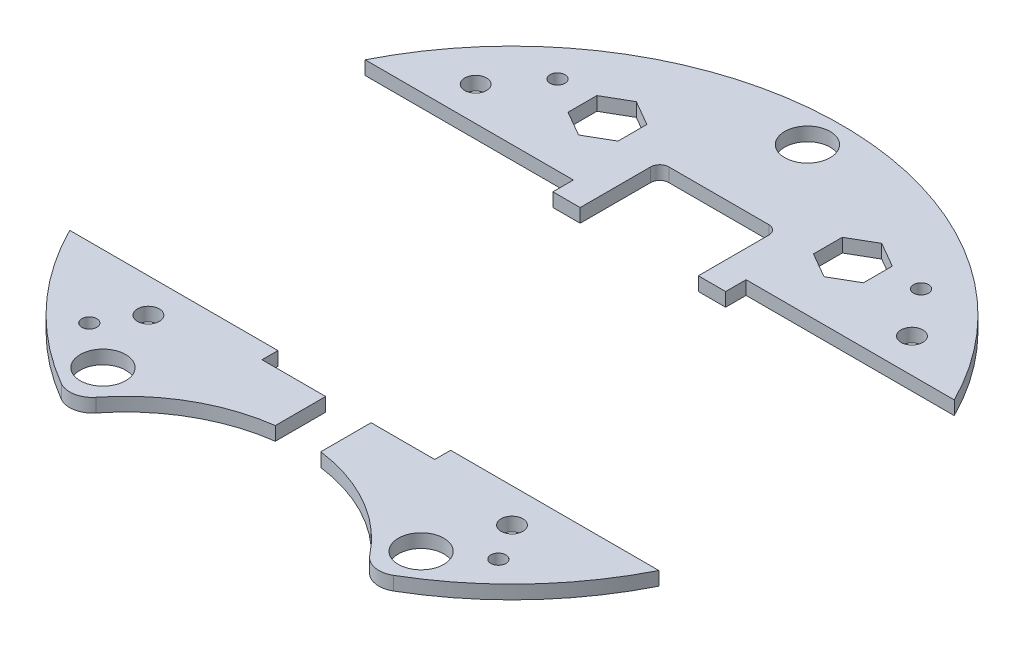
from build123d import *

# Parameters (mm, degrees)
BOSS_EXTRUDE1_DEPTH      = 3
SOLENOID_PLACEMENT_W     = 38
SOLENOID_PLACEMENT_H     = 64
CUT_EXTRUDE1_DEPTH       = 103.574363269
CUT_EXTRUDE4_DEPTH       = 103.574363269
CUT_EXTRUDE5_DEPTH       = 103.574363269
SKETCH6_R                = 2.4
CUT_EXTRUDE6_DEPTH       = 103.574363269
CUT_EXTRUDE3_DEPTH       = 103.574363269
SKETCH7_W                = 10
SKETCH7_H                = 50
CUT_EXTRUDE7_DEPTH       = 98.289516393
SKETCH9_R                = 5
CUT_EXTRUDE11_DEPTH      = 98.289516393
CUT_EXTRUDE12_DEPTH      = 98.289516393
CUT_EXTRUDE12_DEPTH_BACK = 98.289516393
SKETCH10_R               = 5
SKETCH11_R               = 1.65
CUT_EXTRUDE13_DEPTH      = 98.289516393


with BuildPart() as part:
    # Sketch1 → Boss-Extrude1 (new body)
    with BuildSketch(Plane(origin=(0, 0, 0), x_dir=(1, 0, 0), z_dir=(0, 1, 0))):
        with BuildLine():
            ThreePointArc((36.543377003, -62.616544118), (0, 72.5), (-36.543377003, -62.616544118))
            ThreePointArc((-36.543377003, -62.616544118), (-33.085954668, -63.20954405), (-30.089832649, -61.38507948))
            ThreePointArc((-30.089832649, -61.38507948), (0, -46.75), (30.089832649, -61.38507948))
            ThreePointArc((30.089832649, -61.38507948), (33.085954668, -63.20954405), (36.543377003, -62.616544118))
        make_face()
    extrude(amount=BOSS_EXTRUDE1_DEPTH)

    # solenoid placement → Cut-Extrude1 (cut, through all)
    with BuildSketch(Plane(origin=(0, 3, 0), x_dir=(1, 0, 0), z_dir=(0, 1, 0))):
        with Locations((0, -4)):
            Rectangle(SOLENOID_PLACEMENT_W, SOLENOID_PLACEMENT_H)
    extrude(amount=-CUT_EXTRUDE1_DEPTH, mode=Mode.SUBTRACT)

    # Sketch4 → Cut-Extrude4 (cut, through all)
    with BuildSketch(Plane(origin=(0, 3, 0), x_dir=(1, 0, 0), z_dir=(0, 1, 0))):
        with BuildLine():
            Line((-13, 28), (13, 28))
            Line((13, 28), (13, 43.5))
            ThreePointArc((13, 43.5), (12.414213562, 44.914213562), (11, 45.5))
            Line((11, 45.5), (-11, 45.5))
            ThreePointArc((-11, 45.5), (-12.414213562, 44.914213562), (-13, 43.5))
            Line((-13, 43.5), (-13, 28))
        make_face()
    extrude(amount=-CUT_EXTRUDE4_DEPTH, mode=Mode.SUBTRACT)

    # Sketch5 → Cut-Extrude5 (cut, through all)
    with BuildSketch(Plane(origin=(0, 3, 0), x_dir=(1, 0, 0), z_dir=(0, 1, 0))):
        Polygon((-21.5, 51.175426481), (-27, 54.350852961), (-32.5, 51.175426481), (-32.5, 44.824573519), (-27, 41.649147039), (-21.5, 44.824573519), align=None)
        Polygon((21.5, 44.824573519), (21.5, 51.175426481), (27, 54.350852961), (32.5, 51.175426481), (32.5, 44.824573519), (27, 41.649147039), align=None)
    extrude(amount=-CUT_EXTRUDE5_DEPTH, mode=Mode.SUBTRACT)

    # Sketch6 → Cut-Extrude6 (cut, through all)
    with BuildSketch(Plane(origin=(0, 3, 0), x_dir=(1, 0, 0), z_dir=(0, 1, 0))):
        with Locations((40, -40)):
            Circle(SKETCH6_R)
        with Locations((-40, -40)):
            Circle(SKETCH6_R)
        with Locations((48, 40)):
            Circle(SKETCH6_R)
        with Locations((-48, 40)):
            Circle(SKETCH6_R)
    extrude(amount=-CUT_EXTRUDE6_DEPTH, mode=Mode.SUBTRACT)

    # Sketch3 → Cut-Extrude3 (cut, through all)
    with BuildSketch(Plane(origin=(0, 3, 0), x_dir=(1, 0, 0), z_dir=(0, 1, 0))):
        Polygon((-19, 28), (-19, 32.5), (-72.5, 32.5), (-72.5, -32.5), (72.5, -32.5), (72.5, 32.5), (19, 32.5), (19, 28), align=None)
    extrude(amount=-CUT_EXTRUDE3_DEPTH, mode=Mode.SUBTRACT)


with BuildPart() as cut_extrude3_piece_1:
    # of the separate pieces the step leaves, piece 1, a body of its own (cut_extrude3_pieces)
    add(part.part.solids().sort_by_distance((64.807406984, 0, -32.5))[0])

    # Sketch10 → Cut-Extrude12 (cut, two sides: drawn at the far end of the back side and taken through both)
    with BuildSketch(Plane(origin=(0, 3, 0), x_dir=(1, 0, 0), z_dir=(0, 1, 0)).offset(-CUT_EXTRUDE12_DEPTH_BACK)):
        with Locations((0, 65)):
            Circle(SKETCH10_R)
    extrude(amount=CUT_EXTRUDE12_DEPTH + CUT_EXTRUDE12_DEPTH_BACK, mode=Mode.SUBTRACT)


with BuildPart() as cut_extrude3_piece_2:
    # of the separate pieces the step leaves, piece 2, a body of its own (cut_extrude3_pieces)
    add(part.part.solids().sort_by_distance((-36.543377003, 0, 62.616544118))[0])

    # Sketch7 → Cut-Extrude7 (cut, through all)
    with BuildSketch(Plane(origin=(0, 3, 0), x_dir=(1, 0, 0), z_dir=(0, 1, 0))):
        with Locations((0, -25)):
            Rectangle(SKETCH7_W, SKETCH7_H)
    extrude(amount=-CUT_EXTRUDE7_DEPTH, mode=Mode.SUBTRACT)


with BuildPart() as cut_extrude7_piece_1:
    # of the separate pieces the step leaves, piece 1, a body of its own (cut_extrude7_pieces)
    add(cut_extrude3_piece_2.part.solids().sort_by_distance((-36.543377003, 0, 62.616544118))[0])


with BuildPart() as cut_extrude7_piece_2:
    # of the separate pieces the step leaves, piece 2, a body of its own (cut_extrude7_pieces)
    add(cut_extrude3_piece_2.part.solids().sort_by_distance((5, 0, 47.078205475))[0])


with BuildPart() as cut_extrude11_tool:
    # Sketch9 → Cut-Extrude11 (new, through all)
    with BuildSketch(Plane.XZ.offset(-3)):
        with Locations((35, 55)):
            Circle(SKETCH9_R)
        with Locations((-35, 55)):
            Circle(SKETCH9_R)
    extrude(amount=CUT_EXTRUDE11_DEPTH)


with BuildPart() as cut_extrude7_piece_1_1:
    add(cut_extrude7_piece_1.part)

    # Cut-Extrude11: cut by cut_extrude11_tool
    add(cut_extrude11_tool.part, mode=Mode.SUBTRACT)


with BuildPart() as cut_extrude7_piece_2_1:
    add(cut_extrude7_piece_2.part)

    # Cut-Extrude11: cut by cut_extrude11_tool
    add(cut_extrude11_tool.part, mode=Mode.SUBTRACT)


with BuildPart() as cut_extrude13_tool:
    # Sketch11 → Cut-Extrude13 (new, through all)
    with BuildSketch(Plane(origin=(0, 3, 0), x_dir=(1, 0, 0), z_dir=(0, 1, 0))):
        with Locations((45, -48)):
            Circle(SKETCH11_R)
        with Locations((-45, -48)):
            Circle(SKETCH11_R)
        with Locations((40, 50)):
            Circle(SKETCH11_R)
        with Locations((-40, 50)):
            Circle(SKETCH11_R)
    extrude(amount=-CUT_EXTRUDE13_DEPTH)


with BuildPart() as cut_extrude3_piece_1_1:
    add(cut_extrude3_piece_1.part)

    # Cut-Extrude13: cut by cut_extrude13_tool
    add(cut_extrude13_tool.part, mode=Mode.SUBTRACT)


with BuildPart() as cut_extrude7_piece_1_2:
    add(cut_extrude7_piece_1_1.part)

    # Cut-Extrude13: cut by cut_extrude13_tool
    add(cut_extrude13_tool.part, mode=Mode.SUBTRACT)


with BuildPart() as cut_extrude7_piece_2_2:
    add(cut_extrude7_piece_2_1.part)

    # Cut-Extrude13: cut by cut_extrude13_tool
    add(cut_extrude13_tool.part, mode=Mode.SUBTRACT)


solid = Compound([cut_extrude3_piece_1_1.part, cut_extrude7_piece_1_2.part, cut_extrude7_piece_2_2.part])
